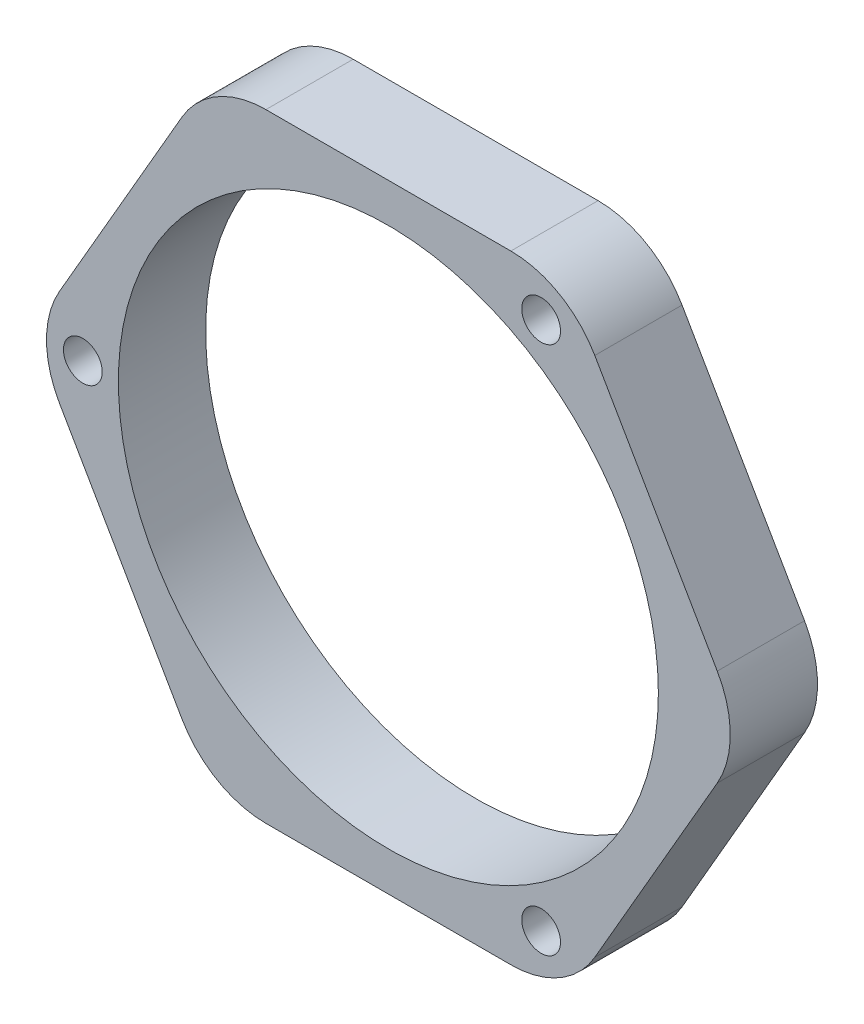
from build123d import *

# Parameters (mm, degrees)
SKETCH1_R           = 27.85
BOSS_EXTRUDE1_DEPTH = 9
FILLET1_R           = 10
SKETCH3_R           = 2
CUT_EXTRUDE1_DEPTH  = 49.383301757
CIRPATTERN1_COUNT   = 3


with BuildPart() as part:
    # Sketch1 → Boss-Extrude1 (new body)
    with BuildSketch(Plane.XY):
        Polygon((18.405926582, -31.88), (36.811853164, 0), (18.405926582, 31.88), (-18.405926582, 31.88), (-36.811853164, 0), (-18.405926582, -31.88), align=None)
        Circle(SKETCH1_R, mode=Mode.SUBTRACT)
    extrude(amount=BOSS_EXTRUDE1_DEPTH)

    # Fillet1
    fillet1_edges = [part.edges().sort_by_distance(p)[0] for p in [
        (-18.405926582, -31.88, 4.5),
        (18.405926582, -31.88, 4.5),
        (-36.811853164, 0, 4.5),
        (36.811853164, 0, 4.5),
        (18.405926582, 31.88, 4.5),
        (-18.405926582, 31.88, 4.5),
    ]]
    fillet(fillet1_edges, radius=FILLET1_R)

    # Sketch3 → Cut-Extrude1 (cut, through all)
    with BuildSketch(Plane.XY.offset(9)):
        with Locations((-31.51484778, 0)):
            Circle(SKETCH3_R)
    cut_extrude1 = extrude(amount=-CUT_EXTRUDE1_DEPTH, mode=Mode.SUBTRACT)

    # CirPattern1: Cut-Extrude1 ×3 about axis
    cirpattern1_axis = Axis((0, 0, 9), (0, 0, 1))
    for i in range(1, CIRPATTERN1_COUNT):
        add(cut_extrude1.rotate(cirpattern1_axis, i * 360 / CIRPATTERN1_COUNT), mode=Mode.SUBTRACT)


solid = part.part
